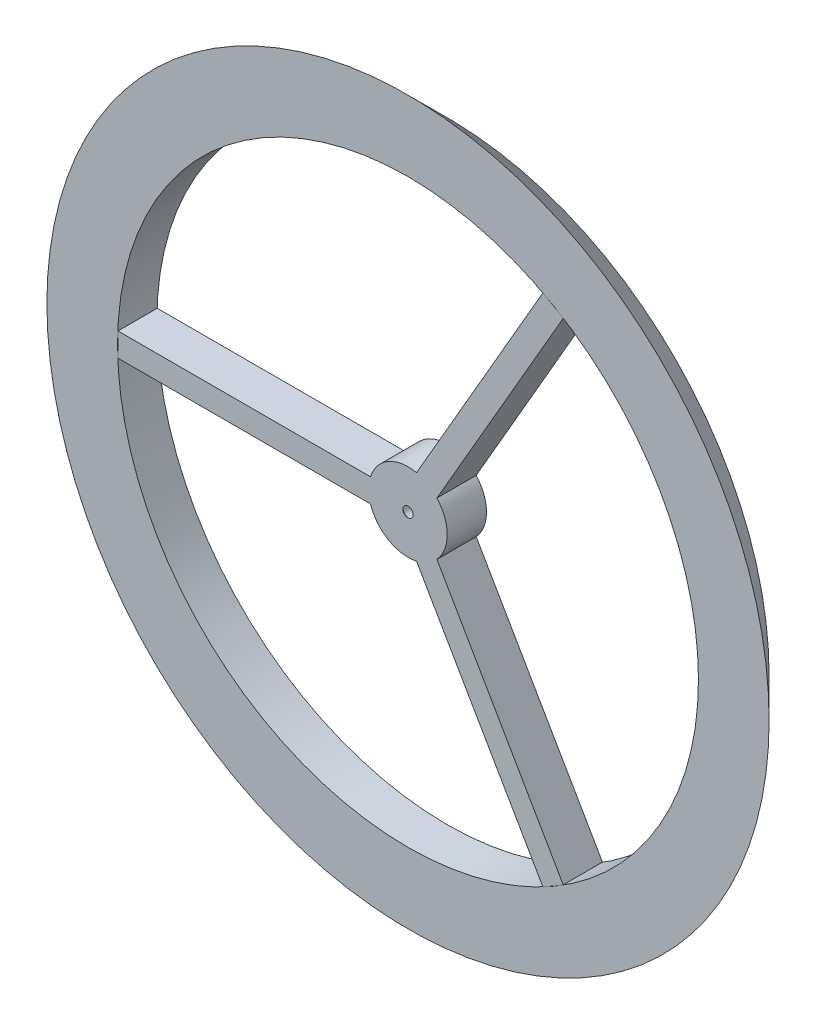
from build123d import *

# Parameters (mm, degrees)
SKETCH1_R           = 46
SKETCH1_R_2         = 37
BOSS_EXTRUDE1_DEPTH = 5
SKETCH7_W           = 36.969582091
SKETCH7_H           = 1.5
BOSS_EXTRUDE4_DEPTH = 5
CIRPATTERN4_COUNT   = 3
SKETCH8_R           = 5
BOSS_EXTRUDE5_DEPTH = 5


# Read off the part's stored shape, not the designer's step: Cavity1
with BuildPart() as part:
    # Sketch1 → Boss-Extrude1 (new body)
    with BuildSketch(Plane.XY):
        Circle(SKETCH1_R)
        Circle(SKETCH1_R_2, mode=Mode.SUBTRACT)
    extrude(amount=BOSS_EXTRUDE1_DEPTH)

    # Sketch6 → Cut-Revolve2 (revolve, cut)
    with BuildSketch(Plane(origin=(0, 0, 0), x_dir=(1, 0, 0), z_dir=(0, 1, 0)), mode=Mode.PRIVATE) as cut_revolve2_sk:
        Polygon((-46, 0), (-41, 0), (-46, -5), align=None)
    revolve(cut_revolve2_sk.sketch.rotate(Axis((0, 0, 0), (0, 0, -1)), 180), axis=Axis((0, 0, 0), (0, 0, -1)), mode=Mode.SUBTRACT)


with BuildPart() as body_2:
    # Sketch7 → Boss-Extrude4 (new body)
    with BuildSketch(Plane(origin=(0, 0, 0), x_dir=(-1, 0, 0), z_dir=(0, 0, -1))):
        with Locations((18.484791045, 0.75)):
            Rectangle(SKETCH7_W, SKETCH7_H)
        with Locations((18.484791045, -0.75)):
            Rectangle(SKETCH7_W, SKETCH7_H)
    extrude(amount=-BOSS_EXTRUDE4_DEPTH)


with BuildPart() as cirpattern4_1:
    # CirPattern4: pattern copy
    add(body_2.part.rotate(Axis((0, 0, 0), (0, 0, 1)), 1 * 360 / CIRPATTERN4_COUNT))


with BuildPart() as cirpattern4_2:
    # CirPattern4: pattern copy
    add(body_2.part.rotate(Axis((0, 0, 0), (0, 0, 1)), 2 * 360 / CIRPATTERN4_COUNT))


with BuildPart() as body_2_1:
    add(body_2.part)

    add(cirpattern4_1.part)  # Boss-Extrude5 merges CirPattern4_1

    add(cirpattern4_2.part)  # Boss-Extrude5 merges CirPattern4_2
    # Sketch8 → Boss-Extrude5 (add)
    with BuildSketch(Plane(origin=(0, 0, 0), x_dir=(-1, 0, 0), z_dir=(0, 0, -1))):
        Circle(SKETCH8_R)
    extrude(amount=-BOSS_EXTRUDE5_DEPTH)

    # Cavity1 outline → Cavity1 (revolve, cut)
    with BuildSketch(Plane.XZ):
        Polygon((0.75, 0), (0.75, 4.9), (0.65, 5), (0, 5), (0, 0), align=None)
    revolve(axis=Axis((0, 0, 0), (0, 0, 1)), mode=Mode.SUBTRACT)


solid = Compound([part.part, body_2_1.part])
